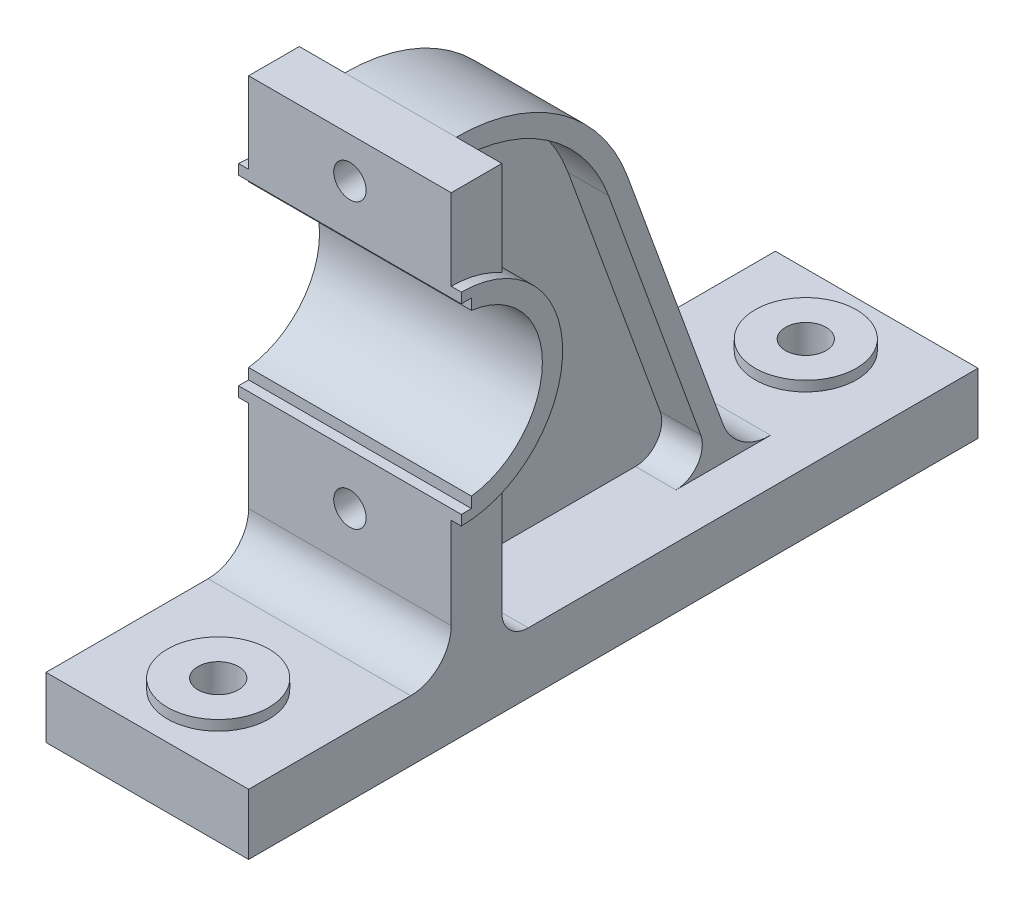
from build123d import *

# Parameters (mm, degrees)
BOSS_EXTRUDE1_DEPTH     = 50
BOSS_EXTRUDE2_DEPTH     = 55
BOSS_EXTRUDE3_DEPTH     = 27.5
CUT_EXTRUDE1_DEPTH      = 20
CUT_EXTRUDE2_DEPTH      = 434.416658655
CUT_EXTRUDE2_DEPTH_BACK = 434.416658655
CUT_EXTRUDE3_DEPTH      = 444.762323773
CUT_EXTRUDE3_DEPTH_BACK = 444.762323773
SKETCH6_W               = 10
SKETCH6_H               = 90
SKETCH7_R               = 25
BOSS_EXTRUDE4_DEPTH     = 5
LPATTERN1_COUNT         = 2
LPATTERN1_PITCH         = 290
HOLE1_D                 = 20
HOLE2_D                 = 16
HOLE2_DEPTH             = 25
LPATTERN2_COUNT         = 2
LPATTERN2_PITCH         = 140
FILLET1_R               = 25
FILLET2_R               = 13
FILLET3_R               = 20
FILLET4_R               = 10


with BuildPart() as part:
    # Sketch1 → Boss-Extrude1 (new, symmetric)
    with BuildSketch(Plane(origin=(0, 0, 0), x_dir=(0, 0, -1), z_dir=(1, 0, 0))):
        Polygon((0, 0), (0, 30), (100, 30), (100, 235), (125, 235), (125, 30), (360, 30), (360, 0), align=None)
    extrude(amount=BOSS_EXTRUDE1_DEPTH, both=True)

    # Sketch2 → Boss-Extrude2 (add, symmetric)
    with BuildSketch(Plane(origin=(0, 0, 0), x_dir=(0, 0, -1), z_dir=(1, 0, 0))):
        with BuildLine():
            Line((100, 195), (100, 95))
            ThreePointArc((100, 95), (150, 145), (100, 195))
        make_face()
    extrude(amount=BOSS_EXTRUDE2_DEPTH, both=True)

    # Sketch3 → Boss-Extrude3 (add, symmetric)
    with BuildSketch(Plane(origin=(0, 0, 0), x_dir=(0, 0, -1), z_dir=(1, 0, 0))):
        with BuildLine():
            Line((125, 235), (125, 30))
            Line((125, 30), (262.632576463, 30))
            Line((262.632576463, 30), (209.572335871, 175.781812899))
            ThreePointArc((209.572335871, 175.781812899), (176.621879272, 218.723683986), (125, 235))
        make_face()
    extrude(amount=BOSS_EXTRUDE3_DEPTH, both=True)

    # Sketch4 → Cut-Extrude1 (cut)
    with BuildSketch(Plane(origin=(27.5, 0, 0), x_dir=(0, 0, -1), z_dir=(1, 0, 0))):
        with BuildLine():
            Line((125, 225), (125, 188.301270189))
            ThreePointArc((125, 188.301270189), (150, 145), (125, 101.698729811))
            Line((125, 101.698729811), (125, 30))
            Line((125, 30), (251.990798739, 30))
            Line((251.990798739, 30), (200.175409663, 172.361611466))
            ThreePointArc((200.175409663, 172.361611466), (170.886114908, 210.532163543), (125, 225))
        make_face()
    cut_extrude1 = extrude(amount=-CUT_EXTRUDE1_DEPTH, mode=Mode.SUBTRACT)

    # Mirror1: Cut-Extrude1 across plane
    add(cut_extrude1.mirror(Plane(origin=(0, 0, 0), x_dir=(0, 0, 1), z_dir=(1, 0, 0))), mode=Mode.SUBTRACT)

    # Sketch5 → Cut-Extrude2 (cut, two sides: drawn at the far end of the back side and taken through both)
    with BuildSketch(Plane(origin=(0, 0, 0), x_dir=(0, 0, -1), z_dir=(1, 0, 0)).offset(-CUT_EXTRUDE2_DEPTH_BACK)):
        with BuildLine():
            Line((100, 185), (100, 105))
            ThreePointArc((100, 105), (140, 145), (100, 185))
        make_face()
    extrude(amount=CUT_EXTRUDE2_DEPTH + CUT_EXTRUDE2_DEPTH_BACK, mode=Mode.SUBTRACT)

    # Sketch6 → Cut-Extrude3 (cut, two sides: drawn at the far end of the back side and taken through both)
    with BuildSketch(Plane(origin=(55, 0, 0), x_dir=(0, 0, -1), z_dir=(1, 0, 0)).offset(-CUT_EXTRUDE3_DEPTH_BACK)):
        with Locations((100, 145)):
            Rectangle(SKETCH6_W, SKETCH6_H)
    extrude(amount=CUT_EXTRUDE3_DEPTH + CUT_EXTRUDE3_DEPTH_BACK, mode=Mode.SUBTRACT)

    # Sketch7 → Boss-Extrude4 (add)
    with BuildSketch(Plane(origin=(0, 30, 0), x_dir=(1, 0, 0), z_dir=(0, 1, 0))):
        with Locations(Location((0, 35, 0), (0, 0, 90))):
            Circle(SKETCH7_R)
    boss_extrude4 = extrude(amount=BOSS_EXTRUDE4_DEPTH)

    # LPattern1: Boss-Extrude4 ×2
    with Locations(*[(0, 0, -i * LPATTERN1_PITCH) for i in range(1, LPATTERN1_COUNT)]):
        add(boss_extrude4)

    # Hole1 (through all)
    with Locations(Plane(origin=(0, 35, 0), x_dir=(1, 0, 0), z_dir=(0, 1, 0))):
        with Locations((0, 35), (0, 325)):
            Hole(HOLE1_D / 2)

    # Hole2
    with Locations(Plane.XY.offset(-100)):
        with Locations((0, 215)):
            hole2 = Hole(HOLE2_D / 2, depth=HOLE2_DEPTH)

    # LPattern2: Hole2 ×2
    with Locations(*[(0, -i * LPATTERN2_PITCH, 0) for i in range(1, LPATTERN2_COUNT)]):
        add(hole2, mode=Mode.SUBTRACT)

    # Fillet1
    fillet1_edges = [part.edges().sort_by_distance(p)[0] for p in [
        (0, 30, -262.632576463),
    ]]
    fillet(fillet1_edges, radius=FILLET1_R)

    # Fillet2
    fillet2_edges = [part.edges().sort_by_distance(p)[0] for p in [
        (28.75, 30, -125),
        (-28.75, 30, -125),
        (17.5, 30, -251.990798739),
        (-17.5, 30, -251.990798739),
    ]]
    fillet(fillet2_edges, radius=FILLET2_R)

    # Fillet3
    fillet3_edges = [part.edges().sort_by_distance(p)[0] for p in [
        (0, 30, -100),
    ]]
    fillet(fillet3_edges, radius=FILLET3_R)

    # Fillet4
    # the kernel refuses this fillet: 10 mm, written as the material it adds along each edge
    with BuildSketch(Plane(origin=(27.5, 225, -125), x_dir=(0, -1, 0), z_dir=(-1, 0, 0))) as fillet4_piece_1:
        with BuildLine():
            CenterArc((10.717967697, -10), FILLET4_R, 90, 98.213210702)
            ThreePointArc((0.820534511, -11.428571429), (0.205397303, -5.728994715), (0, 0))
            Line((0, 0), (10.717967697, 0))
        make_face()
    extrude(amount=48.644973575)
    with BuildSketch(Plane(origin=(-27.5, 225, -125), x_dir=(0, -1, 0), z_dir=(1, 0, 0))) as fillet4_piece_2:
        with BuildLine():
            CenterArc((10.717967697, 10), FILLET4_R, 171.786789298, 98.213210702)
            ThreePointArc((0.820534511, 11.428571429), (0.205397303, 5.728994715), (0, 0))
            Line((0, 0), (10.717967697, 0))
        make_face()
    extrude(amount=48.644973575)


solid = part.part
